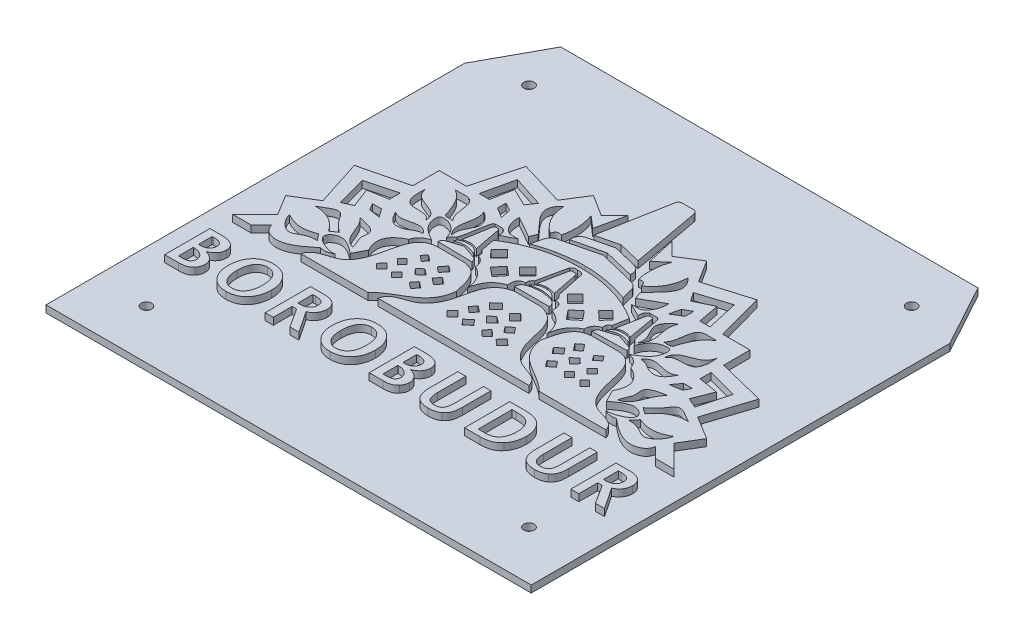
from build123d import *

# Parameters (mm, degrees)
SKETCH2_R           = 1.5
BOSS_EXTRUDE1_DEPTH = 2
BOSS_EXTRUDE6_DEPTH = 2
BOSS_EXTRUDE3_DEPTH = 2


with BuildPart() as part:
    # Sketch2 → Boss-Extrude1 (new body)
    with BuildSketch(Plane(origin=(0, 0, 0), x_dir=(1, 0, 0), z_dir=(0, 1, 0))):
        Polygon((-69.75, 120.33), (-69.75, 0), (69.75, 0), (69.75, 120.33), (59.98, 138.212299614), (-59.98, 138.212299614), align=None)
        with Locations((-55, 124.11)):
            Circle(SKETCH2_R, mode=Mode.SUBTRACT)
        with Locations((55, 124.11)):
            Circle(SKETCH2_R, mode=Mode.SUBTRACT)
        with Locations((55, 14.11)):
            Circle(SKETCH2_R, mode=Mode.SUBTRACT)
        with Locations((-55, 14.11)):
            Circle(SKETCH2_R, mode=Mode.SUBTRACT)
    extrude(amount=BOSS_EXTRUDE1_DEPTH)

    # Sketch5 → Boss-Extrude6 (add)
    # profile 1 of 13: a face of its own
    with BuildSketch(Plane(origin=(0, 2, 0), x_dir=(1, 0, 0), z_dir=(0, 1, 0))):
        with BuildLine():
            Line((-21.685947063, 47.375416064), (0, 47.375416064))
            Line((0, 47.375416064), (0, 56.834459975))
            Line((0, 56.834459975), (-1.725487697, 58.559947673))
            Line((-1.725487697, 58.559947673), (0, 59.906091426))
            Line((0, 59.906091426), (0, 68.72431732))
            Line((0, 68.72431732), (-3.705718193, 68.72431732))
            add(Edge.make_bspline(
                [(-21.685947063, 47.375416064), (-21.060258955, 50.473379201), (-15.335553224, 50.434784162), (-8.814152099, 58.667717265), (-10.54940112, 67.406769007), (-3.705718193, 68.72431732)],
                knots=[0, 0, 0, 0, 0.270546881, 0.473964292, 1, 1, 1, 1], degree=3))
        make_face()
        Polygon((-7.148873874, 52.624754299), (-8.719584105, 54.304881134), (-7.093908743, 55.82468599), (-5.523198513, 54.144559156), align=None, mode=Mode.SUBTRACT)
        Polygon((-4.951639177, 56.908027208), (-6.657904572, 58.248225413), (-5.375777566, 59.880557806), (-3.669512171, 58.540359601), align=None, mode=Mode.SUBTRACT)
        Polygon((-2.898048821, 52.784232434), (-4.319666773, 54.304881134), (-2.548662862, 55.960550161), (-1.12704491, 54.439901461), align=None, mode=Mode.SUBTRACT)
        Polygon((-2.898048821, 60.582139286), (-4.569985162, 62.254075627), (-2.635210078, 64.089457094), (-1.012970545, 62.467217561), align=None, mode=Mode.SUBTRACT)
    # profile 2 of 13: a face of its own
    with BuildSketch(Plane(origin=(0, 2, 0), x_dir=(1, 0, 0), z_dir=(0, 1, 0))):
        with BuildLine():
            Line((-43.862603547, 47.375416064), (-24.601773582, 47.375416064))
            add(Edge.make_bspline(
                [(-24.601773582, 47.375416064), (-20.405865535, 51.940580265), (-12.878495132, 52.375253293), (-12.146705328, 60.413761914)],
                knots=[0, 0, 0, 0, 1, 1, 1, 1], degree=3))
            add(Edge.make_bspline(
                [(-12.146705328, 60.413761914), (-13.085463449, 64.661349461), (-13.878737559, 68.672799202), (-18.730238522, 68.72431732)],
                knots=[0.605840474, 0.605840474, 0.605840474, 0.605840474, 1, 1, 1, 1], degree=3))
            Line((-18.730238522, 68.72431732), (-25.754130931, 68.72431732))
            add(Edge.make_bspline(
                [(-43.862603547, 47.375416064), (-42.952067047, 50.584414035), (-36.495790346, 50.097398851), (-31.364544587, 59.441623611), (-31.920905438, 68.658833235), (-25.754130931, 68.72431732)],
                knots=[0, 0, 0, 0, 0.285537985, 0.49898124, 1, 1, 1, 1], degree=3))
        make_face()
        Polygon((-29.245304108, 54.464676026), (-30.636489675, 55.837739367), (-29.093815535, 57.400774322), (-27.702629969, 56.027710981), align=None, mode=Mode.SUBTRACT)
        Polygon((-24.888496356, 54.464676026), (-26.279681923, 55.837739367), (-24.770847726, 57.366487746), (-23.379662159, 55.993424406), align=None, mode=Mode.SUBTRACT)
        Polygon((-27.191051852, 58.540359601), (-28.751244165, 60.080228127), (-27.406910157, 61.442305181), (-25.846717844, 59.902436654), align=None, mode=Mode.SUBTRACT)
        Polygon((-19.403651932, 54.464676026), (-21.15175938, 55.837739367), (-19.859856979, 57.482517245), (-18.111749532, 56.109453904), align=None, mode=Mode.SUBTRACT)
        Polygon((-23.709253906, 60.17330123), (-22.242184726, 61.464011125), (-20.528212778, 60.080228127), (-22.242184726, 58.540359601), align=None, mode=Mode.SUBTRACT)
        Polygon((-17.059132435, 58.719434182), (-18.910114644, 60.17330123), (-17.610300681, 61.828151667), (-15.759318472, 60.374284619), align=None, mode=Mode.SUBTRACT)
        Polygon((-24.601773582, 62.771532138), (-26.279681923, 64.089457094), (-25.221568029, 65.436588522), (-23.543659688, 64.118663566), align=None, mode=Mode.SUBTRACT)
        Polygon((-19.403651932, 62.467217561), (-20.994406375, 63.716686873), (-19.514400299, 65.60094783), (-17.923645856, 64.351478518), align=None, mode=Mode.SUBTRACT)
    # profile 3 of 13: a face of its own
    with BuildSketch(Plane(origin=(0, 2, 0), x_dir=(1, 0, 0), z_dir=(0, 1, 0))):
        with BuildLine():
            add(Edge.make_bspline(
                [(0, 84.072732516), (-10.605144416, 84.196980499), (-19.514400299, 78.444899873)],
                knots=[0, 0, 0, 1, 1, 1], degree=2))
            Line((-19.514400299, 78.444899873), (-18.730238522, 74.22402539))
            add(Edge.make_bspline(
                [(-18.730238522, 74.22402539), (-17.50465765, 73.60292555), (-17.823355982, 72.360168701)],
                knots=[0, 0, 0, 1, 1, 1], degree=2))
            add(Edge.make_bspline(
                [(-17.823355982, 72.360168701), (-15.651043662, 71.672558294), (-15.569397993, 69.324225287)],
                knots=[0, 0, 0, 1, 1, 1], degree=2))
            add(Edge.make_bspline(
                [(-15.569397993, 69.324225287), (-11.767100871, 67.373494286), (-11.422946411, 62.891858127)],
                knots=[0, 0, 0, 1, 1, 1], degree=2))
            add(Edge.make_bspline(
                [(-11.422946411, 62.891858127), (-10.806738639, 67.764759062), (-6.356849183, 69.324225287)],
                knots=[0, 0, 0, 1, 1, 1], degree=2))
            add(Edge.make_bspline(
                [(-4.308362372, 72.360168701), (-6.684498085, 72.443487873), (-6.356849183, 69.324225287)],
                knots=[0, 0, 0, 1, 1, 1], degree=2))
            add(Edge.make_bspline(
                [(-4.308362372, 72.360168701), (-4.471910005, 73.597868022), (-3.483689743, 74.22402539)],
                knots=[0, 0, 0, 1, 1, 1], degree=2))
            Line((-3.483689743, 74.22402539), (-1.725487697, 82.436599441))
            add(Edge.make_bspline(
                [(0, 83.069948021), (-1.111076659, 83.406438521), (-1.725487697, 82.436599441)],
                knots=[0, 0, 0, 1, 1, 1], degree=2))
            Line((0, 83.069948021), (0, 84.072732516))
        make_face()
        Polygon((-10.697634727, 69.150168696), (-13.267673722, 71.256828518), (-11.092987525, 73.909856914), (-8.52294853, 71.803197092), align=None, mode=Mode.SUBTRACT)
        Polygon((-15.569397993, 73.645589213), (-17.577881173, 75.719926188), (-15.108278915, 78.111126199), (-13.099795735, 76.036789224), align=None, mode=Mode.SUBTRACT)
        Polygon((-6.921347807, 73.280151554), (-9.106381439, 75.50434696), (-6.690376122, 77.877813275), (-4.50534249, 75.653617869), align=None, mode=Mode.SUBTRACT)
    # profile 4 of 13: a face of its own
    with BuildSketch(Plane(origin=(0, 2, 0), x_dir=(1, 0, 0), z_dir=(0, 1, 0))):
        with BuildLine():
            add(Edge.make_bspline(
                [(0, 82.001172293), (-0.546282657, 82.146451828), (-0.883939505, 81.893888755), (-1.012970545, 81.243483073)],
                knots=[0, 0, 0, 0, 1, 1, 1, 1], degree=3))
            Line((-1.012970545, 81.243483073), (-2.467855457, 73.909856914))
            add(Edge.make_bspline(
                [(0, 74.457217273), (-1.254338521, 74.275246977), (-2.467855457, 73.909856914)],
                knots=[0, 0, 0, 1, 1, 1], degree=2))
            Line((0, 74.457217273), (0, 82.001172293))
        make_face()
    # profile 5 of 13: a face of its own
    with BuildSketch(Plane(origin=(0, 2, 0), x_dir=(1, 0, 0), z_dir=(0, 1, 0))):
        with BuildLine():
            Line((-8.719584105, 89.505081705), (0, 91.601082332))
            Line((0, 91.601082332), (0, 94.090083078))
            Line((0, 94.090083078), (-6.921347807, 92.426339811))
            add(Edge.make_bspline(
                [(-6.921347807, 92.426339811), (-8.915714161, 91.748628923), (-8.719584105, 89.505081705)],
                knots=[0, 0, 0, 1, 1, 1], degree=2))
        make_face()
    # profile 6 of 13: a face of its own
    with BuildSketch(Plane(origin=(0, 2, 0), x_dir=(1, 0, 0), z_dir=(0, 1, 0))):
        with BuildLine():
            Line((-6.356849183, 94.090083078), (0, 95.618416869))
            Line((0, 95.618416869), (0, 114.802334585))
            Line((0, 114.802334585), (-1.460599159, 114.802334585))
            add(Edge.make_bspline(
                [(-2.773638411, 113.757871544), (-2.545004362, 114.841627513), (-1.460599159, 114.802334585)],
                knots=[0, 0, 0, 1, 1, 1], degree=2))
            Line((-2.773638411, 113.757871544), (-6.356849183, 94.090083078))
        make_face()
    # profile 7 of 13: a face of its own
    with BuildSketch(Plane(origin=(0, 2, 0), x_dir=(1, 0, 0), z_dir=(0, 1, 0))):
        with BuildLine():
            Line((0, 85.185550604), (0, 90.489540898))
            Line((0, 90.489540898), (-10.193302484, 87.973071407))
            add(Edge.make_bspline(
                [(-10.193302484, 87.973071407), (-11.712262793, 87.686106305), (-12.479258747, 86.366740633)],
                knots=[0, 0, 0, 1, 1, 1], degree=2))
            Line((-12.479258747, 86.366740633), (-13.435245105, 82.724397612))
            add(Edge.make_bspline(
                [(-13.435245105, 82.724397612), (-6.950689866, 85.146034045), (0, 85.185550604)],
                knots=[0, 0, 0, 1, 1, 1], degree=2))
        make_face()
    # profile 8 of 13: a face of its own
    with BuildSketch(Plane(origin=(0, 2, 0), x_dir=(1, 0, 0), z_dir=(0, 1, 0))):
        with BuildLine():
            Line((-8.193733671, 95.618416869), (-6.356849183, 103.918443139))
            Line((-6.356849183, 103.918443139), (-10.193302484, 100.081989839))
            Line((-10.193302484, 100.081989839), (-16.282384704, 103.918443139))
            Line((-16.282384704, 103.918443139), (-20.269820633, 97.589726661))
            Line((-20.269820633, 97.589726661), (-33.217016615, 101.470850103))
            Line((-33.217016615, 101.470850103), (-36.838711138, 87.973071407))
            Line((-36.838711138, 87.973071407), (-44.675064357, 87.973071407))
            Line((-44.675064357, 87.973071407), (-44.675064357, 80.394354512))
            Line((-44.675064357, 80.394354512), (-58.170820404, 77.050670469))
            Line((-58.170820404, 77.050670469), (-53.86305666, 63.735764351))
            Line((-53.86305666, 63.735764351), (-60.522708481, 59.674192515))
            Line((-60.522708481, 59.674192515), (-56.981509517, 53.867782317))
            Line((-56.981509517, 53.867782317), (-63.473875771, 47.375416064))
            Line((-63.473875771, 47.375416064), (-58.170820404, 47.375416064))
            Line((-58.170820404, 47.375416064), (-55.152153766, 50.394082702))
            add(Edge.make_bspline(
                [(-55.152153766, 50.394082702), (-54.896607666, 48.453862725), (-49.672270582, 45.698470367), (-44.861077302, 49.799119086), (-42.545623721, 51.713327892)],
                knots=[0, 0, 0, 0, 0.336939276, 1, 1, 1, 1], degree=3))
            add(Edge.make_bspline(
                [(-42.545623721, 51.713327892), (-40.660950606, 51.172930467), (-38.936225155, 52.262069486)],
                knots=[0, 0, 0, 1, 1, 1], degree=2))
            add(Edge.make_bspline(
                [(-38.936225155, 52.262069486), (-40.004542308, 51.708672366), (-47.04770612, 54.012503598), (-41.84608072, 58.747336878), (-38.331384044, 55.730766175), (-36.838711138, 54.539877226)],
                knots=[0, 0, 0, 0, 0.430133885, 0.559822654, 1, 1, 1, 1], degree=3))
            Line((-36.838711138, 54.539877226), (-35.014421637, 58.051707637))
            add(Edge.make_bspline(
                [(-35.014421637, 58.051707637), (-38.022264734, 63.518611764), (-31.943460414, 66.433353682)],
                knots=[0, 0, 0, 1, 1, 1], degree=2))
            add(Edge.make_bspline(
                [(-31.943460414, 66.433353682), (-31.089336219, 68.974456749), (-28.477832624, 69.557436335)],
                knots=[0, 0, 0, 1, 1, 1], degree=2))
            add(Edge.make_bspline(
                [(-28.477832624, 69.557436335), (-30.531971797, 70.80246416), (-33.22732518, 72.114260458), (-33.495995055, 76.718344296), (-29.666868317, 76.917194385), (-27.600331635, 74.751069735), (-26.965665509, 72.360168701)],
                knots=[0, 0, 0, 0, 0.406746933, 0.533052717, 0.591310573, 1, 1, 1, 1], degree=3))
            add(Edge.make_bspline(
                [(-26.965665509, 72.360168701), (-26.426092207, 73.293491741), (-25.546850669, 73.909856914)],
                knots=[0, 0, 0, 1, 1, 1], degree=2))
            add(Edge.make_bspline(
                [(-25.546850669, 73.909856914), (-24.533624412, 77.188877898), (-24.687426532, 79.262411391), (-23.838965761, 82.467379634), (-23.379662159, 82.724397612)],
                knots=[0, 0, 0, 0, 0.838059053, 1, 1, 1, 1], degree=3))
            Line((-23.379662159, 82.724397612), (-21.15175938, 82.724397612))
            add(Edge.make_bspline(
                [(-21.15175938, 82.724397612), (-19.820338229, 82.097804143), (-20.033682515, 80.394354512)],
                knots=[0, 0, 0, 1, 1, 1], degree=2))
            Line((-20.033682515, 80.394354512), (-16.282384704, 82.290049201))
            Line((-16.282384704, 82.290049201), (-18.730238522, 82.290049201))
            add(Edge.make_bspline(
                [(-21.473946494, 87.795967907), (-21.651320235, 85.706944754), (-20.741157941, 83.215314086), (-18.730238522, 82.290049201)],
                knots=[0, 0, 0, 0, 1, 1, 1, 1], degree=3))
            Line((-21.473946494, 87.795967907), (-15.382914795, 84.37249437))
            Line((-15.382914795, 84.37249437), (-14.607234621, 86.366740633))
            add(Edge.make_bspline(
                [(-17.823355982, 96.952208014), (-22.456785664, 92.859316657), (-16.859001025, 89.467206487), (-14.607234621, 86.366740633)],
                knots=[0, 0, 0, 0, 1, 1, 1, 1], degree=3))
            add(Edge.make_bspline(
                [(-17.823355982, 96.952208014), (-17.577869158, 91.407765522), (-13.108443862, 88.298374539)],
                knots=[0, 0, 0, 1, 1, 1], degree=2))
            add(Edge.make_bspline(
                [(-11.092987525, 89.505081705), (-12.825632139, 90.086815881), (-13.108443862, 88.298374539)],
                knots=[0, 0, 0, 1, 1, 1], degree=2))
            add(Edge.make_bspline(
                [(-11.608127068, 98.577547296), (-9.946740821, 94.151219529), (-11.092987525, 89.505081705)],
                knots=[0, 0, 0, 1, 1, 1], degree=2))
            Line((-11.608127068, 98.577547296), (-8.193733671, 95.618416869))
        make_face()
        with BuildLine():
            add(Edge.make_bspline(
                [(-55.152153766, 55.453674615), (-50.846199128, 52.864413107), (-46.306227135, 54.898343312)],
                knots=[0, 0, 0, 1, 1, 1], degree=2))
            Line((-46.306227135, 54.898343312), (-44.675064357, 52.954683753))
            add(Edge.make_bspline(
                [(-55.152153766, 55.453674615), (-55.074916803, 53.884746974), (-52.161074063, 50.127119855), (-48.277083317, 52.336513812), (-46.380781819, 53.264049619), (-44.675064357, 52.954683753)],
                knots=[0, 0, 0, 0, 0.513801539, 0.617376106, 1, 1, 1, 1], degree=3))
        make_face(mode=Mode.SUBTRACT)
        with BuildLine():
            Line((-43.66590592, 58.237606571), (-45.491439378, 56.981247199))
            add(Edge.make_bspline(
                [(-53.663369583, 61.332687709), (-52.06146859, 61.317415129), (-48.955474971, 60.667359118), (-46.585693663, 58.571236379), (-45.491439378, 56.981247199)],
                knots=[0.00519792, 0.00519792, 0.00519792, 0.00519792, 0.462660874, 1, 1, 1, 1], degree=3))
            add(Edge.make_bspline(
                [(-53.663369583, 61.332687709), (-53.159810356, 61.376361772), (-51.02221802, 63.139867278), (-48.191190741, 63.695675519), (-46.526940219, 60.572909899), (-45.029377376, 59.325441602), (-43.66590592, 58.237606571)],
                knots=[0.011540337, 0.011540337, 0.011540337, 0.011540337, 0.305760969, 0.436150392, 0.629288219, 0.980307848, 0.980307848, 0.980307848, 0.980307848], degree=3))
        make_face(mode=Mode.SUBTRACT)
        with BuildLine():
            add(Edge.make_bspline(
                [(-44.341456174, 64.856575027), (-41.415035499, 62.520759202), (-42.171272147, 57.6442623), (-38.029171466, 56.462113072)],
                knots=[0, 0, 0, 0, 1, 1, 1, 1], degree=3))
            add(Edge.make_bspline(
                [(-44.341456174, 64.856575027), (-43.362111113, 64.585255235), (-38.435539768, 64.16906248), (-39.739263745, 59.454525834), (-38.521201004, 58.512236145), (-38.029171466, 56.462113072)],
                knots=[0, 0, 0, 0, 0.474826613, 0.654778699, 1, 1, 1, 1], degree=3))
        make_face(mode=Mode.SUBTRACT)
        Polygon((-48.086153541, 67.06045108), (-50.967432225, 65.831670465), (-53.303401548, 74.457217273), (-44.675064357, 76.763580764), (-44.675064357, 73.645589213), (-50.289484299, 72.681020081), align=None, mode=Mode.SUBTRACT)
        Polygon((-44.950644386, 68.24685995), (-46.009938019, 70.128065635), (-43.432616461, 70.128065635), (-41.688019994, 67.73658245), align=None, mode=Mode.SUBTRACT)
        with BuildLine():
            add(Edge.make_bspline(
                [(-40.64572554, 71.394186706), (-40.148961681, 70.498089092), (-38.758331512, 67.674331104), (-34.408029759, 68.277937487), (-32.885232532, 70.103591604), (-31.282680848, 69.914345584)],
                knots=[0, 0, 0, 0, 0.360982783, 0.637936432, 1, 1, 1, 1], degree=3))
            add(Edge.make_bspline(
                [(-40.64572554, 71.394186706), (-37.590726625, 68.98929967), (-33.708894027, 73.606136142), (-31.282680848, 69.914345584)],
                knots=[0, 0, 0, 0, 1, 1, 1, 1], degree=3))
        make_face(mode=Mode.SUBTRACT)
        with BuildLine():
            add(Edge.make_bspline(
                [(-41.955522698, 81.243483073), (-42.22428706, 79.832064816), (-42.303268998, 73.087843744), (-35.319106899, 76.123005378), (-34.237886067, 73.645589213)],
                knots=[0, 0, 0, 0, 0.454885445, 1, 1, 1, 1], degree=3))
            add(Edge.make_bspline(
                [(-41.955522698, 81.243483073), (-41.302131938, 76.436217087), (-34.354173944, 78.682785762), (-34.237886067, 73.645589213)],
                knots=[0, 0, 0, 0, 1, 1, 1, 1], degree=3))
        make_face(mode=Mode.SUBTRACT)
        with BuildLine():
            add(Edge.make_bspline(
                [(-27.958861736, 84.072732516), (-26.78492251, 83.490954423), (-24.177587977, 81.021756454), (-26.325360358, 77.248666697), (-27.294488536, 75.217247875), (-26.783259703, 73.645589213)],
                knots=[0, 0, 0, 0, 0.404519616, 0.640918639, 1, 1, 1, 1], degree=3))
            add(Edge.make_bspline(
                [(-26.783259703, 73.645589213), (-29.966404665, 76.726432198), (-26.240813452, 80.589365636), (-27.958861736, 84.072732516)],
                knots=[0, 0, 0, 0, 1, 1, 1, 1], degree=3))
        make_face(mode=Mode.SUBTRACT)
        with BuildLine():
            add(Edge.make_bspline(
                [(-37.602051673, 85.511073009), (-35.321422363, 84.072264289), (-34.429990485, 82.514160022), (-32.827893949, 78.409112918), (-32.829169694, 77.553903826), (-31.858512233, 77.444557082), (-30.2456342, 77.533070382)],
                knots=[0, 0, 0, 0, 0.537998494, 0.598899625, 0.784193301, 1, 1, 1, 1], degree=3))
            add(Edge.make_bspline(
                [(-37.602051673, 85.511073009), (-36.289324477, 85.364697372), (-32.542283137, 86.252048183), (-31.549956338, 81.208411397), (-31.500238286, 78.846165322), (-30.2456342, 77.533070382)],
                knots=[0, 0, 0, 0, 0.366526676, 0.616997506, 1, 1, 1, 1], degree=3))
        make_face(mode=Mode.SUBTRACT)
        Polygon((-26.965665509, 87.010465432), (-26.965665509, 89.484432934), (-24.71046724, 88.247449183), (-23.963917516, 85.185550604), align=None, mode=Mode.SUBTRACT)
        Polygon((-29.101454657, 94.090083078), (-30.2456342, 87.973071407), (-33.217016615, 87.973071407), (-31.168124063, 96.952208014), (-22.242184726, 94.090083078), (-23.963917516, 91.601082332), align=None, mode=Mode.SUBTRACT)
    # profile 9 of 13: a face of its own
    with BuildSketch(Plane(origin=(0, 2, 0), x_dir=(1, 0, 0), z_dir=(0, 1, 0))):
        with BuildLine():
            Line((-17.823355982, 71.203215624), (-22.242184726, 72.681020081))
            Line((-22.242184726, 72.681020081), (-26.279681923, 71.394186706))
            add(Edge.make_bspline(
                [(-26.279681923, 71.394186706), (-27.100600825, 71.007259758), (-27.191051852, 70.128065635)],
                knots=[0, 0, 0, 1, 1, 1], degree=2))
            Line((-27.191051852, 70.128065635), (-17.170028295, 69.914345584))
            add(Edge.make_bspline(
                [(-17.170028295, 69.914345584), (-17.409964726, 70.6054808), (-17.823355982, 71.203215624)],
                knots=[0, 0, 0, 1, 1, 1], degree=2))
        make_face()
    # profile 10 of 13: a face of its own
    with BuildSketch(Plane(origin=(0, 2, 0), x_dir=(1, 0, 0), z_dir=(0, 1, 0))):
        with BuildLine():
            Line((0, 72.863683069), (0, 73.909856914))
            add(Edge.make_bspline(
                [(0, 73.909856914), (-2.061009085, 73.977492317), (-3.259865327, 72.360168701)],
                knots=[0, 0, 0, 1, 1, 1], degree=2))
            add(Edge.make_bspline(
                [(-3.259865327, 72.360168701), (-1.65571789, 72.776082937), (0, 72.863683069)],
                knots=[0, 0, 0, 1, 1, 1], degree=2))
        make_face()
    # profile 11 of 13: a face of its own
    with BuildSketch(Plane(origin=(0, 2, 0), x_dir=(1, 0, 0), z_dir=(0, 1, 0))):
        with BuildLine():
            Line((0, 69.914345584), (0, 72.518389135))
            add(Edge.make_bspline(
                [(0, 72.518389135), (-1.855205383, 72.198900744), (-4.97109912, 72.396342834), (-4.990840685, 69.914345584)],
                knots=[0, 0, 0, 0, 1, 1, 1, 1], degree=3))
            Line((-4.990840685, 69.914345584), (0, 69.914345584))
        make_face()
    # profile 12 of 13: a face of its own
    with BuildSketch(Plane(origin=(0, 2, 0), x_dir=(1, 0, 0), z_dir=(0, 1, 0))):
        with BuildLine():
            Line((-22.942476295, 81.459020177), (-24.240400614, 73.909856914))
            add(Edge.make_bspline(
                [(-24.240400614, 73.909856914), (-22.052597695, 75.052671214), (-19.859856979, 73.815253187)],
                knots=[0, 0, 0, 1, 1, 1], degree=2))
            Line((-19.859856979, 73.815253187), (-21.33837595, 81.459020177))
            add(Edge.make_bspline(
                [(-22.942476295, 81.459020177), (-22.87340473, 82.238055205), (-21.406887322, 82.247046407), (-21.33837595, 81.459020177)],
                knots=[0, 0, 0, 0, 1, 1, 1, 1], degree=3))
        make_face()
    # profile 13 of 13: a face of its own
    with BuildSketch(Plane(origin=(0, 2, 0), x_dir=(1, 0, 0), z_dir=(0, 1, 0))):
        with BuildLine():
            add(Edge.make_bspline(
                [(-25.080663656, 72.518389135), (-24.965710915, 73.512063672), (-22.215298508, 74.283838798), (-19.753844714, 73.76740847), (-19.075811587, 72.184269314)],
                knots=[0, 0, 0, 0, 0.375200626, 1, 1, 1, 1], degree=3))
            add(Edge.make_bspline(
                [(-25.080663656, 72.518389135), (-22.020877752, 73.767950381), (-19.075811587, 72.184269314)],
                knots=[0, 0, 0, 1, 1, 1], degree=2))
        make_face()
    boss_extrude6 = extrude(amount=BOSS_EXTRUDE6_DEPTH)

    # Sketch4 → Boss-Extrude3 (add)
    # profile 1 of 9: a face of its own
    with BuildSketch(Plane(origin=(0, 2, 0), x_dir=(1, 0, 0), z_dir=(0, 1, 0))):
        with BuildLine():
            Line((-63.190382072, 27.57485914), (-63.190382072, 40.57485914))
            Line((-63.190382072, 40.57485914), (-59.726972262, 40.57485914))
            add(Edge.make_bspline(
                [(-59.726972262, 40.57485914), (-59.560634849, 40.57231935), (-59.237839889, 40.567390626), (-58.768132822, 40.531438895), (-58.328098746, 40.471121102), (-57.917677881, 40.38302625), (-57.535167811, 40.273889278), (-57.18262391, 40.137390402), (-56.858349793, 39.978847229), (-56.567418163, 39.792455972), (-56.305905779, 39.58712148), (-56.078269653, 39.360538769), (-55.886582505, 39.113811344), (-55.726953643, 38.849802505), (-55.606828241, 38.564315861), (-55.518156126, 38.260920242), (-55.466756071, 37.937691212), (-55.459772266, 37.715861975), (-55.456204857, 37.602549013)],
                knots=[0, 0, 0, 0, 1.362329124, 2.643740613, 3.855923336, 4.997334728, 6.079255232, 7.1104524, 8.089960293, 9.030559553, 9.935048454, 10.808691022, 11.654038174, 12.488353738, 13.328085846, 14.183401101, 15.072060086, 16, 16, 16, 16], degree=3))
            add(Edge.make_bspline(
                [(-55.456204857, 37.602549013), (-55.457954779, 37.510742097), (-55.4614176, 37.329070632), (-55.496011669, 37.059697665), (-55.553315878, 36.796914938), (-55.629651371, 36.539154701), (-55.730403265, 36.288663349), (-55.855496366, 36.046393698), (-55.999680465, 35.80852983), (-56.165719013, 35.579015318), (-56.350082259, 35.361995413), (-56.548475637, 35.158662018), (-56.765996239, 34.977644603), (-56.994708486, 34.808700698), (-57.239616085, 34.660116168), (-57.499243616, 34.528078845), (-57.773105751, 34.411974097), (-57.964327371, 34.350266132), (-58.060833022, 34.31912338)],
                knots=[0, 0, 0, 0, 0.979780781, 1.938832256, 2.893640022, 3.848973806, 4.805621365, 5.771415319, 6.756947662, 7.772811149, 8.792130523, 9.795053602, 10.801477005, 11.809936653, 12.828434261, 13.855609147, 14.917769676, 16, 16, 16, 16], degree=3))
            add(Edge.make_bspline(
                [(-58.060833022, 34.31912338), (-57.935257914, 34.281936386), (-57.690582709, 34.209479865), (-57.338487691, 34.079904742), (-57.01165806, 33.936842493), (-56.707202388, 33.782716296), (-56.430303149, 33.611903091), (-56.173023439, 33.432516815), (-55.941771377, 33.236952261), (-55.734344291, 33.028496596), (-55.554291889, 32.804636623), (-55.392446132, 32.572329005), (-55.262648301, 32.321813959), (-55.14962772, 32.061767611), (-55.06581072, 31.786393975), (-55.007082949, 31.498797712), (-54.970005711, 31.198645158), (-54.96506084, 30.993811077), (-54.962533971, 30.889139203)],
                knots=[0, 0, 0, 0, 1.252214904, 2.439862028, 3.585003243, 4.662718613, 5.700128529, 6.693913851, 7.659411643, 8.59253357, 9.5014021, 10.403928705, 11.294918556, 12.194649511, 13.112418274, 14.041535909, 14.999208987, 16, 16, 16, 16], degree=3))
            add(Edge.make_bspline(
                [(-54.962533971, 30.889139203), (-54.965384743, 30.79648494), (-54.971025272, 30.613159474), (-55.004711675, 30.340153712), (-55.063626532, 30.072246924), (-55.149716124, 29.81070419), (-55.25548759, 29.552855821), (-55.386808217, 29.3019446), (-55.54231377, 29.055626258), (-55.660731895, 28.899057149), (-55.721038718, 28.819321165)],
                knots=[0, 0, 0, 0, 0.989353177, 1.957531433, 2.932217871, 3.913241294, 4.893795134, 5.90474953, 6.932951346, 8, 8, 8, 8], degree=3))
            add(Edge.make_bspline(
                [(-55.721038718, 28.819321165), (-55.811379958, 28.714234455), (-55.99125225, 28.505003463), (-56.316597462, 28.245895868), (-56.673873199, 28.026227117), (-57.00302485, 27.887132323), (-57.286373943, 27.794263465), (-57.51946243, 27.736359926), (-57.770244101, 27.687948057), (-58.038721532, 27.646911787), (-58.325099776, 27.613527217), (-58.630456992, 27.590512301), (-58.952940281, 27.578382255), (-59.174154436, 27.57605132), (-59.287296629, 27.57485914)],
                knots=[0, 0, 0, 0, 1.270750891, 2.530105562, 3.802270756, 5.114386342, 5.801682221, 6.540795849, 7.319137977, 8.147721502, 9.035587203, 9.967477548, 10.960446054, 12, 12, 12, 12], degree=3))
            Line((-59.287296629, 27.57485914), (-63.190382072, 27.57485914))
        make_face()
        with BuildLine():
            Line((-60.886584604, 29.22042876), (-60.855730174, 29.22042876))
            add(Edge.make_bspline(
                [(-60.855730174, 29.22042876), (-60.704011761, 29.220319728), (-60.415082001, 29.220112089), (-60.003703368, 29.234791928), (-59.63489019, 29.250744314), (-59.309289696, 29.277574393), (-59.025465178, 29.304937639), (-58.785838037, 29.348029769), (-58.586456537, 29.389570596), (-58.471867398, 29.432642313), (-58.420801376, 29.451836988)],
                knots=[0, 0, 0, 0, 1.482266668, 2.822801435, 4.021753692, 5.088575845, 6.015208937, 6.805456394, 7.467658198, 8, 8, 8, 8], degree=3))
            add(Edge.make_bspline(
                [(-58.420801376, 29.451836988), (-58.342355745, 29.488949595), (-58.189836477, 29.56110642), (-57.98725887, 29.705874348), (-57.812219041, 29.870030222), (-57.671723418, 30.061473412), (-57.562537885, 30.27510552), (-57.486254197, 30.511230019), (-57.43863728, 30.769815658), (-57.433540536, 30.94977038), (-57.430888402, 31.043411355)],
                knots=[0, 0, 0, 0, 1.039713238, 2.021480356, 2.974590915, 3.908637338, 4.856348109, 5.841987667, 6.877059873, 8, 8, 8, 8], degree=3))
            add(Edge.make_bspline(
                [(-57.430888402, 31.043411355), (-57.43393898, 31.128455973), (-57.439957935, 31.296253567), (-57.485221463, 31.542306229), (-57.557414227, 31.779224376), (-57.659961561, 32.005042761), (-57.79422746, 32.219303141), (-57.956955739, 32.422343215), (-58.148767953, 32.615547434), (-58.365878962, 32.797274189), (-58.606951796, 32.960453248), (-58.864613612, 33.103815898), (-59.135658983, 33.230209152), (-59.424752051, 33.325305769), (-59.727812894, 33.403662376), (-60.045834556, 33.459488893), (-60.379293337, 33.493898693), (-60.606238014, 33.497216826), (-60.722027642, 33.498909773)],
                knots=[0, 0, 0, 0, 0.894144232, 1.764194531, 2.622536105, 3.493986475, 4.364550394, 5.275489014, 6.225343975, 7.223797199, 8.248998366, 9.282254075, 10.323072634, 11.389310387, 12.478212914, 13.613557871, 14.782411422, 16, 16, 16, 16], degree=3))
            Line((-60.722027642, 33.498909773), (-60.886584604, 33.498909773))
            Line((-60.886584604, 33.498909773), (-60.886584604, 29.22042876))
        make_face(mode=Mode.SUBTRACT)
        with BuildLine():
            Line((-60.886584604, 34.979922431), (-60.637177958, 34.979922431))
            add(Edge.make_bspline(
                [(-60.637177958, 34.979922431), (-60.524006699, 34.98227492), (-60.304226831, 34.986843482), (-59.984481868, 35.011245976), (-59.685448046, 35.057489802), (-59.407437827, 35.122405228), (-59.148681122, 35.199595956), (-58.912795513, 35.302002835), (-58.695835903, 35.419462045), (-58.499121342, 35.556488348), (-58.324535487, 35.709822756), (-58.172899743, 35.880060119), (-58.043100531, 36.064691909), (-57.941794294, 36.267797785), (-57.856136062, 36.482745971), (-57.803108446, 36.715258364), (-57.76374723, 36.96184216), (-57.761275796, 37.131842694), (-57.760002326, 37.219439836)],
                knots=[0, 0, 0, 0, 1.312680442, 2.549240275, 3.716077788, 4.817982517, 5.858647313, 6.842756131, 7.794714152, 8.715706293, 9.617126575, 10.483047133, 11.354370684, 12.225694235, 13.109906139, 14.030844638, 14.985342117, 16, 16, 16, 16], degree=3))
            add(Edge.make_bspline(
                [(-57.760002326, 37.219439836), (-57.761573702, 37.289023873), (-57.764619955, 37.423918702), (-57.799749331, 37.618850876), (-57.853228897, 37.800427811), (-57.928639782, 37.96885993), (-58.023467712, 38.125281156), (-58.14511597, 38.265468587), (-58.285729609, 38.393366624), (-58.448147899, 38.507884328), (-58.631454399, 38.608926601), (-58.83833216, 38.690759918), (-59.063007976, 38.768081832), (-59.311704636, 38.824370281), (-59.579872872, 38.874196665), (-59.871092829, 38.907300464), (-60.182738476, 38.923682107), (-60.398039144, 38.92738679), (-60.508617832, 38.92928952)],
                knots=[0, 0, 0, 0, 0.912554305, 1.76906747, 2.591416314, 3.392314647, 4.185508419, 4.98371465, 5.820108707, 6.675586453, 7.587099544, 8.560870266, 9.59278258, 10.703582191, 11.90427079, 13.172999656, 14.548049147, 16, 16, 16, 16], degree=3))
            Line((-60.508617832, 38.92928952), (-60.886584604, 38.92928952))
            Line((-60.886584604, 38.92928952), (-60.886584604, 34.979922431))
        make_face(mode=Mode.SUBTRACT)
    # profile 2 of 9: a face of its own
    with BuildSketch(Plane(origin=(0, 2, 0), x_dir=(1, 0, 0), z_dir=(0, 1, 0))):
        with BuildLine():
            add(Edge.make_bspline(
                [(-45.286584604, 27.245745216), (-45.51228832, 27.250711534), (-45.953475614, 27.260419288), (-46.597860679, 27.349978518), (-47.20692935, 27.496005635), (-47.782011679, 27.69903018), (-48.321120416, 27.963370615), (-48.824685473, 28.287323762), (-49.295890447, 28.66698394), (-49.726380026, 29.104712327), (-50.114097342, 29.589869933), (-50.451754451, 30.116856611), (-50.739255785, 30.681526172), (-50.973720699, 31.285289069), (-51.151907642, 31.929307819), (-51.283619011, 32.609963605), (-51.361077955, 33.329984056), (-51.370414023, 33.822692335), (-51.375192199, 34.07485914)],
                knots=[0, 0, 0, 0, 1.04988093, 2.052221971, 3.02056282, 3.960392271, 4.884372062, 5.80819689, 6.741299476, 7.694565407, 8.659425506, 9.626385429, 10.602090815, 11.603479166, 12.635102297, 13.707522298, 14.826715928, 16, 16, 16, 16], degree=3))
            add(Edge.make_bspline(
                [(-51.375192199, 34.07485914), (-51.370394129, 34.327021752), (-51.361019188, 34.819721839), (-51.283927452, 35.538962778), (-51.151493194, 36.218600135), (-50.973909546, 36.861947274), (-50.738427325, 37.466038619), (-50.45331624, 38.032060538), (-50.113098525, 38.55747152), (-49.726683045, 39.042740654), (-49.29485536, 39.479708857), (-48.826448961, 39.863168699), (-48.318986474, 40.183365043), (-47.780857957, 40.450924042), (-47.205012954, 40.653095058), (-46.597118391, 40.800148151), (-45.953452907, 40.889220323), (-45.512280636, 40.898980121), (-45.286584604, 40.903973064)],
                knots=[0, 0, 0, 0, 1.173422404, 2.292747988, 3.361378182, 4.393122943, 5.394629358, 6.374006117, 7.337725989, 8.302699846, 9.256078168, 10.191802304, 11.113589481, 12.043017773, 12.982958032, 13.947536069, 14.949995288, 16, 16, 16, 16], degree=3))
            add(Edge.make_bspline(
                [(-45.286584604, 40.903973064), (-45.052273712, 40.899309773), (-44.593829205, 40.89018574), (-43.926090905, 40.796420686), (-43.293451757, 40.652722503), (-42.700268513, 40.442380134), (-42.142026676, 40.177953258), (-41.626064876, 39.848059586), (-41.145346163, 39.462206049), (-40.708874362, 39.016823117), (-40.313210369, 38.52764572), (-39.969427107, 37.997629863), (-39.680673189, 37.430926508), (-39.44384979, 36.828912874), (-39.257848012, 36.191329542), (-39.129034981, 35.517195116), (-39.046562352, 34.807989293), (-39.037864503, 34.322788588), (-39.033420047, 34.07485914)],
                knots=[0, 0, 0, 0, 1.076622274, 2.106481542, 3.093843531, 4.054713365, 4.994117713, 5.927677438, 6.863703814, 7.822219533, 8.789017835, 9.751929696, 10.72119817, 11.70830851, 12.722113646, 13.770027837, 14.860521505, 16, 16, 16, 16], degree=3))
            add(Edge.make_bspline(
                [(-39.033420047, 34.07485914), (-39.037928615, 33.826940136), (-39.046767428, 33.340907911), (-39.128559749, 32.630715062), (-39.258663577, 31.956286988), (-39.440706119, 31.317859578), (-39.677774359, 30.715582911), (-39.969703499, 30.150039642), (-40.313471639, 29.620500015), (-40.705090385, 29.129238341), (-41.144896289, 28.688221564), (-41.621913739, 28.297327101), (-42.142151954, 27.973929226), (-42.697998433, 27.706321541), (-43.291000062, 27.497207043), (-43.923485784, 27.353237872), (-44.59211765, 27.259429631), (-45.051417575, 27.250379163), (-45.286584604, 27.245745216)],
                knots=[0, 0, 0, 0, 1.139233166, 2.233406972, 3.281095549, 4.293586971, 5.280484787, 6.251344728, 7.214049276, 8.17817151, 9.13368299, 10.071984022, 11.006572474, 11.942223167, 12.902886126, 13.890035538, 14.919673078, 16, 16, 16, 16], degree=3))
        make_face()
        with BuildLine():
            add(Edge.make_bspline(
                [(-45.286584604, 28.891314836), (-45.142348358, 28.89488758), (-44.860082117, 28.901879339), (-44.448444958, 28.967763308), (-44.061003812, 29.075448303), (-43.698113632, 29.225272455), (-43.359995875, 29.417408793), (-43.046765138, 29.65373471), (-42.758201632, 29.933104295), (-42.495408788, 30.253338889), (-42.261893423, 30.612850618), (-42.055495915, 31.006547166), (-41.883846936, 31.436967854), (-41.741738702, 31.901171404), (-41.636655354, 32.401572458), (-41.555950458, 32.934476993), (-41.510219307, 33.502392267), (-41.504643938, 33.892223929), (-41.501774477, 34.092857557)],
                knots=[0, 0, 0, 0, 0.95352057, 1.866012696, 2.749113222, 3.608231015, 4.456278502, 5.314610294, 6.196691157, 7.106961516, 8.048849422, 9.027669002, 10.04253589, 11.109583688, 12.234906327, 13.421537003, 14.672949282, 16, 16, 16, 16], degree=3))
            add(Edge.make_bspline(
                [(-41.501774477, 34.092857557), (-41.504616862, 34.291783492), (-41.510138301, 34.678204615), (-41.556210465, 35.240914001), (-41.635715883, 35.769143999), (-41.745073097, 36.263662561), (-41.886453665, 36.72395743), (-42.058786315, 37.150105398), (-42.261602357, 37.544100279), (-42.498576747, 37.900527685), (-42.759699059, 38.221946186), (-43.050304568, 38.498411328), (-43.362426122, 38.735054545), (-43.700766983, 38.926812585), (-44.062406216, 39.077095779), (-44.449664775, 39.181502834), (-44.860035343, 39.248004678), (-45.14233254, 39.254886749), (-45.286584604, 39.258403444)],
                knots=[0, 0, 0, 0, 1.321931509, 2.567901765, 3.748872939, 4.869611187, 5.930810184, 6.945191616, 7.920951225, 8.870420642, 9.784991243, 10.667294854, 11.529681522, 12.381735301, 13.244911683, 14.125172007, 15.041974869, 16, 16, 16, 16], degree=3))
            add(Edge.make_bspline(
                [(-45.286584604, 39.258403444), (-45.420527286, 39.254599234), (-45.683034812, 39.247143554), (-46.067360189, 39.184069247), (-46.430940517, 39.079025601), (-46.773750276, 38.930967794), (-47.094966117, 38.741715368), (-47.394984799, 38.510718326), (-47.674647272, 38.238230872), (-47.931046102, 37.923921843), (-48.161749342, 37.571464505), (-48.364649908, 37.182993721), (-48.529325783, 36.755791386), (-48.66921002, 36.293704194), (-48.775414907, 35.794688953), (-48.852025469, 35.259566946), (-48.898597709, 34.688490414), (-48.904038322, 34.29521561), (-48.906837769, 34.092857557)],
                knots=[0, 0, 0, 0, 0.905866815, 1.775362819, 2.626920279, 3.460738132, 4.295201074, 5.143097521, 6.016626093, 6.931433207, 7.88202747, 8.862489859, 9.890931759, 10.975199444, 12.126311355, 13.33929097, 14.630942303, 16, 16, 16, 16], degree=3))
            add(Edge.make_bspline(
                [(-48.906837769, 34.092857557), (-48.904044018, 33.88878444), (-48.898613217, 33.492084586), (-48.851932313, 32.915901484), (-48.775776359, 32.376400005), (-48.66866234, 31.873353184), (-48.52998988, 31.4074431), (-48.36379942, 30.976646088), (-48.163188974, 30.584382404), (-47.931036794, 30.230860654), (-47.673765594, 29.916717728), (-47.396002486, 29.64131179), (-47.094095775, 29.41108168), (-46.774525526, 29.218441131), (-46.432019965, 29.070466185), (-46.067665373, 28.969076798), (-45.684176142, 28.901753868), (-45.420579762, 28.894832968), (-45.286584604, 28.891314836)],
                knots=[0, 0, 0, 0, 1.374329448, 2.671573298, 3.890424906, 5.041907675, 6.132268139, 7.161373192, 8.147602944, 9.093843773, 10.004461348, 10.878023224, 11.722036563, 12.555621368, 13.385620587, 14.226132478, 15.098281781, 16, 16, 16, 16], degree=3))
        make_face(mode=Mode.SUBTRACT)
    # profile 3 of 9: a face of its own
    with BuildSketch(Plane(origin=(0, 2, 0), x_dir=(1, 0, 0), z_dir=(0, 1, 0))):
        with BuildLine():
            Line((-34.294179541, 27.57485914), (-34.294179541, 40.57485914))
            Line((-34.294179541, 40.57485914), (-30.311386819, 40.57485914))
            add(Edge.make_bspline(
                [(-30.311386819, 40.57485914), (-30.151890999, 40.572656442), (-29.840906771, 40.568361633), (-29.388801596, 40.527464565), (-28.966597293, 40.457156814), (-28.571488198, 40.366890269), (-28.207043971, 40.242894595), (-27.869414192, 40.094151668), (-27.562114406, 39.915761842), (-27.283633832, 39.712486931), (-27.034711424, 39.486015793), (-26.820488788, 39.234352512), (-26.637393573, 38.963776994), (-26.484561921, 38.67255748), (-26.374059842, 38.357259321), (-26.291634303, 38.023281252), (-26.237681583, 37.668570121), (-26.233193126, 37.424481354), (-26.230888402, 37.299147114)],
                knots=[0, 0, 0, 0, 1.290583137, 2.516373155, 3.669208613, 4.752664155, 5.792341044, 6.779708414, 7.733821168, 8.661939487, 9.565233447, 10.450722791, 11.32988713, 12.204717746, 13.104275762, 14.026152812, 14.986472673, 16, 16, 16, 16], degree=3))
            add(Edge.make_bspline(
                [(-26.230888402, 37.299147114), (-26.232928901, 37.200520501), (-26.236984467, 37.004496501), (-26.267525246, 36.713615477), (-26.32324746, 36.430690756), (-26.393478531, 36.153776236), (-26.490584752, 35.88548522), (-26.605754501, 35.623035225), (-26.742617251, 35.367817749), (-26.899569827, 35.121583341), (-27.072650642, 34.886614315), (-27.261649998, 34.667385069), (-27.462490675, 34.462588447), (-27.678900507, 34.276257564), (-27.906162501, 34.101968756), (-28.148132048, 33.944722584), (-28.405276815, 33.806452302), (-28.583879571, 33.726660007), (-28.673530807, 33.686607557)],
                knots=[0, 0, 0, 0, 1.023519239, 2.034281908, 3.030379068, 4.014168393, 4.996025718, 5.987664977, 6.986498618, 7.998200148, 9.015788814, 10.012402117, 10.999883876, 11.989766323, 12.973555648, 13.970288024, 14.981168098, 16, 16, 16, 16], degree=3))
            Line((-28.673530807, 33.686607557), (-24.585318781, 27.57485914))
            Line((-24.585318781, 27.57485914), (-27.197660553, 27.57485914))
            Line((-27.197660553, 27.57485914), (-30.694495996, 33.005238887))
            Line((-30.694495996, 33.005238887), (-31.990382072, 33.005238887))
            Line((-31.990382072, 33.005238887), (-31.990382072, 27.57485914))
            Line((-31.990382072, 27.57485914), (-34.294179541, 27.57485914))
        make_face()
        with BuildLine():
            Line((-31.990382072, 34.650808507), (-31.740975427, 34.650808507))
            add(Edge.make_bspline(
                [(-31.740975427, 34.650808507), (-31.612367061, 34.652914174), (-31.362542595, 34.657004478), (-31.000059333, 34.684723666), (-30.662286886, 34.732846862), (-30.349175675, 34.801930078), (-30.061151394, 34.891751898), (-29.796160856, 34.999441774), (-29.556588303, 35.127967548), (-29.340470305, 35.275589823), (-29.149510915, 35.442162976), (-28.985055132, 35.630374162), (-28.847245055, 35.836989618), (-28.72837626, 36.059489338), (-28.642628972, 36.3026762), (-28.581092401, 36.563041399), (-28.541423981, 36.841122009), (-28.536972106, 37.033317816), (-28.53468587, 37.13201895)],
                knots=[0, 0, 0, 0, 1.336446071, 2.596074721, 3.775030883, 4.879218195, 5.9243162, 6.906777425, 7.847201582, 8.743973421, 9.621204624, 10.473298707, 11.332946512, 12.197425259, 13.087716357, 14.003655333, 14.974787819, 16, 16, 16, 16], degree=3))
            add(Edge.make_bspline(
                [(-28.53468587, 37.13201895), (-28.536479572, 37.205002408), (-28.539957622, 37.346519793), (-28.572054151, 37.55159018), (-28.621538743, 37.743492816), (-28.698749181, 37.918985326), (-28.789789727, 38.083952105), (-28.908494027, 38.229854065), (-29.042142413, 38.366652185), (-29.201226293, 38.483202699), (-29.377802505, 38.590490955), (-29.576200709, 38.682333612), (-29.795829409, 38.759357044), (-30.036203392, 38.820032292), (-30.296448295, 38.868464444), (-30.577921833, 38.904808131), (-30.880200761, 38.92436526), (-31.088721284, 38.927617953), (-31.19588049, 38.92928952)],
                knots=[0, 0, 0, 0, 0.960655628, 1.862743634, 2.728128611, 3.562700094, 4.381858034, 5.201715811, 6.031923592, 6.894431934, 7.790850831, 8.750444521, 9.768051655, 10.852357116, 12.0125803, 13.253226618, 14.588426451, 16, 16, 16, 16], degree=3))
            Line((-31.19588049, 38.92928952), (-31.990382072, 38.92928952))
            Line((-31.990382072, 38.92928952), (-31.990382072, 34.650808507))
        make_face(mode=Mode.SUBTRACT)
    # profile 4 of 9: a face of its own
    with BuildSketch(Plane(origin=(0, 2, 0), x_dir=(1, 0, 0), z_dir=(0, 1, 0))):
        with BuildLine():
            add(Edge.make_bspline(
                [(-15.4030403, 27.245745216), (-15.628744017, 27.250711534), (-16.06993131, 27.260419288), (-16.714316375, 27.349978518), (-17.323385046, 27.496005635), (-17.898467375, 27.69903018), (-18.437576112, 27.963370615), (-18.94114117, 28.287323762), (-19.412346143, 28.66698394), (-19.842835722, 29.104712327), (-20.230553038, 29.589869933), (-20.568210147, 30.116856611), (-20.855711482, 30.681526172), (-21.090176395, 31.285289069), (-21.268363338, 31.929307819), (-21.400074707, 32.609963605), (-21.477533651, 33.329984056), (-21.48686972, 33.822692335), (-21.491647895, 34.07485914)],
                knots=[0, 0, 0, 0, 1.04988093, 2.052221971, 3.02056282, 3.960392271, 4.884372062, 5.80819689, 6.741299476, 7.694565407, 8.659425506, 9.626385429, 10.602090815, 11.603479166, 12.635102297, 13.707522298, 14.826715928, 16, 16, 16, 16], degree=3))
            add(Edge.make_bspline(
                [(-21.491647895, 34.07485914), (-21.486849825, 34.327021752), (-21.477474884, 34.819721839), (-21.400383148, 35.538962778), (-21.26794889, 36.218600135), (-21.090365242, 36.861947274), (-20.854883021, 37.466038619), (-20.569771937, 38.032060538), (-20.229554221, 38.55747152), (-19.843138742, 39.042740654), (-19.411311056, 39.479708857), (-18.942904657, 39.863168699), (-18.43544217, 40.183365043), (-17.897313654, 40.450924042), (-17.32146865, 40.653095058), (-16.713574087, 40.800148151), (-16.069908603, 40.889220323), (-15.628736332, 40.898980121), (-15.4030403, 40.903973064)],
                knots=[0, 0, 0, 0, 1.173422404, 2.292747988, 3.361378182, 4.393122943, 5.394629358, 6.374006117, 7.337725989, 8.302699846, 9.256078168, 10.191802304, 11.113589481, 12.043017773, 12.982958032, 13.947536069, 14.949995288, 16, 16, 16, 16], degree=3))
            add(Edge.make_bspline(
                [(-15.4030403, 40.903973064), (-15.168729409, 40.899309773), (-14.710284901, 40.89018574), (-14.042546601, 40.796420686), (-13.409907454, 40.652722503), (-12.816724209, 40.442380134), (-12.258482372, 40.177953258), (-11.742520573, 39.848059586), (-11.261801859, 39.462206049), (-10.825330058, 39.016823117), (-10.429666066, 38.52764572), (-10.085882803, 37.997629863), (-9.797128885, 37.430926508), (-9.560305487, 36.828912874), (-9.374303709, 36.191329542), (-9.245490677, 35.517195116), (-9.163018048, 34.807989293), (-9.154320199, 34.322788588), (-9.149875743, 34.07485914)],
                knots=[0, 0, 0, 0, 1.076622274, 2.106481542, 3.093843531, 4.054713365, 4.994117713, 5.927677438, 6.863703814, 7.822219533, 8.789017835, 9.751929696, 10.72119817, 11.70830851, 12.722113646, 13.770027837, 14.860521505, 16, 16, 16, 16], degree=3))
            add(Edge.make_bspline(
                [(-9.149875743, 34.07485914), (-9.154384312, 33.826940136), (-9.163223124, 33.340907911), (-9.245015445, 32.630715062), (-9.375119273, 31.956286988), (-9.557161816, 31.317859578), (-9.794230055, 30.715582911), (-10.086159196, 30.150039642), (-10.429927335, 29.620500015), (-10.821546082, 29.129238341), (-11.261351985, 28.688221564), (-11.738369435, 28.297327101), (-12.25860765, 27.973929226), (-12.814454129, 27.706321541), (-13.407455758, 27.497207043), (-14.03994148, 27.353237872), (-14.708573346, 27.259429631), (-15.167873271, 27.250379163), (-15.4030403, 27.245745216)],
                knots=[0, 0, 0, 0, 1.139233166, 2.233406972, 3.281095549, 4.293586971, 5.280484787, 6.251344728, 7.214049276, 8.17817151, 9.13368299, 10.071984022, 11.006572474, 11.942223167, 12.902886126, 13.890035538, 14.919673078, 16, 16, 16, 16], degree=3))
        make_face()
        with BuildLine():
            add(Edge.make_bspline(
                [(-15.4030403, 28.891314836), (-15.258804054, 28.89488758), (-14.976537813, 28.901879339), (-14.564900654, 28.967763308), (-14.177459508, 29.075448303), (-13.814569328, 29.225272455), (-13.476451571, 29.417408793), (-13.163220834, 29.65373471), (-12.874657329, 29.933104295), (-12.611864484, 30.253338889), (-12.378349119, 30.612850618), (-12.171951611, 31.006547166), (-12.000302632, 31.436967854), (-11.858194398, 31.901171404), (-11.75311105, 32.401572458), (-11.672406154, 32.934476993), (-11.626675004, 33.502392267), (-11.621099634, 33.892223929), (-11.618230174, 34.092857557)],
                knots=[0, 0, 0, 0, 0.95352057, 1.866012696, 2.749113222, 3.608231015, 4.456278502, 5.314610294, 6.196691157, 7.106961516, 8.048849422, 9.027669002, 10.04253589, 11.109583688, 12.234906327, 13.421537003, 14.672949282, 16, 16, 16, 16], degree=3))
            add(Edge.make_bspline(
                [(-11.618230174, 34.092857557), (-11.621072558, 34.291783492), (-11.626593997, 34.678204615), (-11.672666161, 35.240914001), (-11.752171579, 35.769143999), (-11.861528793, 36.263662561), (-12.002909361, 36.72395743), (-12.175242011, 37.150105398), (-12.378058053, 37.544100279), (-12.615032443, 37.900527685), (-12.876154755, 38.221946186), (-13.166760264, 38.498411328), (-13.478881819, 38.735054545), (-13.81722268, 38.926812585), (-14.178861912, 39.077095779), (-14.566120471, 39.181502834), (-14.976491039, 39.248004678), (-15.258788236, 39.254886749), (-15.4030403, 39.258403444)],
                knots=[0, 0, 0, 0, 1.321931509, 2.567901765, 3.748872939, 4.869611187, 5.930810184, 6.945191616, 7.920951225, 8.870420642, 9.784991243, 10.667294854, 11.529681522, 12.381735301, 13.244911683, 14.125172007, 15.041974869, 16, 16, 16, 16], degree=3))
            add(Edge.make_bspline(
                [(-15.4030403, 39.258403444), (-15.536982982, 39.254599234), (-15.799490508, 39.247143554), (-16.183815885, 39.184069247), (-16.547396213, 39.079025601), (-16.890205972, 38.930967794), (-17.211421813, 38.741715368), (-17.511440496, 38.510718326), (-17.791102968, 38.238230872), (-18.047501798, 37.923921843), (-18.278205038, 37.571464505), (-18.481105605, 37.182993721), (-18.645781479, 36.755791386), (-18.785665716, 36.293704194), (-18.891870604, 35.794688953), (-18.968481165, 35.259566946), (-19.015053405, 34.688490414), (-19.020494018, 34.29521561), (-19.023293465, 34.092857557)],
                knots=[0, 0, 0, 0, 0.905866815, 1.775362819, 2.626920279, 3.460738132, 4.295201074, 5.143097521, 6.016626093, 6.931433207, 7.88202747, 8.862489859, 9.890931759, 10.975199444, 12.126311355, 13.33929097, 14.630942303, 16, 16, 16, 16], degree=3))
            add(Edge.make_bspline(
                [(-19.023293465, 34.092857557), (-19.020499714, 33.88878444), (-19.015068913, 33.492084586), (-18.968388009, 32.915901484), (-18.892232055, 32.376400005), (-18.785118037, 31.873353184), (-18.646445577, 31.4074431), (-18.480255116, 30.976646088), (-18.27964467, 30.584382404), (-18.04749249, 30.230860654), (-17.79022129, 29.916717728), (-17.512458182, 29.64131179), (-17.210551471, 29.41108168), (-16.890981222, 29.218441131), (-16.548475661, 29.070466185), (-16.184121069, 28.969076798), (-15.800631839, 28.901753868), (-15.537035458, 28.894832968), (-15.4030403, 28.891314836)],
                knots=[0, 0, 0, 0, 1.374329448, 2.671573298, 3.890424906, 5.041907675, 6.132268139, 7.161373192, 8.147602944, 9.093843773, 10.004461348, 10.878023224, 11.722036563, 12.555621368, 13.385620587, 14.226132478, 15.098281781, 16, 16, 16, 16], degree=3))
        make_face(mode=Mode.SUBTRACT)
    # profile 5 of 9: a face of its own
    with BuildSketch(Plane(origin=(0, 2, 0), x_dir=(1, 0, 0), z_dir=(0, 1, 0))):
        with BuildLine():
            Line((-4.410635237, 27.57485914), (-4.410635237, 40.57485914))
            Line((-4.410635237, 40.57485914), (-0.947225427, 40.57485914))
            add(Edge.make_bspline(
                [(-0.947225427, 40.57485914), (-0.780888014, 40.57231935), (-0.458093054, 40.567390626), (0.011614013, 40.531438895), (0.45164809, 40.471121102), (0.862068954, 40.38302625), (1.244579025, 40.273889278), (1.597122925, 40.137390402), (1.921397043, 39.978847229), (2.212328672, 39.792455972), (2.473841057, 39.58712148), (2.701477182, 39.360538769), (2.89316433, 39.113811344), (3.052793192, 38.849802505), (3.172918595, 38.564315861), (3.26159071, 38.260920242), (3.312990765, 37.937691212), (3.319974569, 37.715861975), (3.323541978, 37.602549013)],
                knots=[0, 0, 0, 0, 1.362329124, 2.643740613, 3.855923336, 4.997334728, 6.079255232, 7.1104524, 8.089960293, 9.030559553, 9.935048454, 10.808691022, 11.654038174, 12.488353738, 13.328085846, 14.183401101, 15.072060086, 16, 16, 16, 16], degree=3))
            add(Edge.make_bspline(
                [(3.323541978, 37.602549013), (3.321792056, 37.510742097), (3.318329235, 37.329070632), (3.283735167, 37.059697665), (3.226430957, 36.796914938), (3.150095464, 36.539154701), (3.04934357, 36.288663349), (2.924250469, 36.046393698), (2.780066371, 35.80852983), (2.614027823, 35.579015318), (2.429664576, 35.361995413), (2.231271199, 35.158662018), (2.013750597, 34.977644603), (1.78503835, 34.808700698), (1.54013075, 34.660116168), (1.28050322, 34.528078845), (1.006641084, 34.411974097), (0.815419465, 34.350266132), (0.718913814, 34.31912338)],
                knots=[0, 0, 0, 0, 0.979780781, 1.938832256, 2.893640022, 3.848973806, 4.805621365, 5.771415319, 6.756947662, 7.772811149, 8.792130523, 9.795053602, 10.801477005, 11.809936653, 12.828434261, 13.855609147, 14.917769676, 16, 16, 16, 16], degree=3))
            add(Edge.make_bspline(
                [(0.718913814, 34.31912338), (0.844488922, 34.281936386), (1.089164126, 34.209479865), (1.441259144, 34.079904742), (1.768088776, 33.936842493), (2.072544447, 33.782716296), (2.349443686, 33.611903091), (2.606723396, 33.432516815), (2.837975458, 33.236952261), (3.045402545, 33.028496596), (3.225454947, 32.804636623), (3.387300703, 32.572329005), (3.517098535, 32.321813959), (3.630119116, 32.061767611), (3.713936115, 31.786393975), (3.772663886, 31.498797712), (3.809741125, 31.198645158), (3.814685995, 30.993811077), (3.817212864, 30.889139203)],
                knots=[0, 0, 0, 0, 1.252214904, 2.439862028, 3.585003243, 4.662718613, 5.700128529, 6.693913851, 7.659411643, 8.59253357, 9.5014021, 10.403928705, 11.294918556, 12.194649511, 13.112418274, 14.041535909, 14.999208987, 16, 16, 16, 16], degree=3))
            add(Edge.make_bspline(
                [(3.817212864, 30.889139203), (3.814362092, 30.79648494), (3.808721563, 30.613159474), (3.77503516, 30.340153712), (3.716120303, 30.072246924), (3.630030711, 29.81070419), (3.524259246, 29.552855821), (3.392938619, 29.3019446), (3.237433065, 29.055626258), (3.119014941, 28.899057149), (3.058708117, 28.819321165)],
                knots=[0, 0, 0, 0, 0.989353177, 1.957531433, 2.932217871, 3.913241294, 4.893795134, 5.90474953, 6.932951346, 8, 8, 8, 8], degree=3))
            add(Edge.make_bspline(
                [(3.058708117, 28.819321165), (2.968366877, 28.714234455), (2.788494585, 28.505003463), (2.463149373, 28.245895868), (2.105873636, 28.026227117), (1.776721986, 27.887132323), (1.493372892, 27.794263465), (1.260284405, 27.736359926), (1.009502734, 27.687948057), (0.741025304, 27.646911787), (0.454647059, 27.613527217), (0.149289843, 27.590512301), (-0.173193446, 27.578382255), (-0.394407601, 27.57605132), (-0.507549794, 27.57485914)],
                knots=[0, 0, 0, 0, 1.270750891, 2.530105562, 3.802270756, 5.114386342, 5.801682221, 6.540795849, 7.319137977, 8.147721502, 9.035587203, 9.967477548, 10.960446054, 12, 12, 12, 12], degree=3))
            Line((-0.507549794, 27.57485914), (-4.410635237, 27.57485914))
        make_face()
        with BuildLine():
            Line((-2.106837769, 29.22042876), (-2.075983338, 29.22042876))
            add(Edge.make_bspline(
                [(-2.075983338, 29.22042876), (-1.924264926, 29.220319728), (-1.635335165, 29.220112089), (-1.223956533, 29.234791928), (-0.855143355, 29.250744314), (-0.52954286, 29.277574393), (-0.245718342, 29.304937639), (-0.006091201, 29.348029769), (0.193290298, 29.389570596), (0.307879438, 29.432642313), (0.358945459, 29.451836988)],
                knots=[0, 0, 0, 0, 1.482266668, 2.822801435, 4.021753692, 5.088575845, 6.015208937, 6.805456394, 7.467658198, 8, 8, 8, 8], degree=3))
            add(Edge.make_bspline(
                [(0.358945459, 29.451836988), (0.43739109, 29.488949595), (0.589910359, 29.56110642), (0.792487965, 29.705874348), (0.967527794, 29.870030222), (1.108023418, 30.061473412), (1.21720895, 30.27510552), (1.293492639, 30.511230019), (1.341109555, 30.769815658), (1.3462063, 30.94977038), (1.348858434, 31.043411355)],
                knots=[0, 0, 0, 0, 1.039713238, 2.021480356, 2.974590915, 3.908637338, 4.856348109, 5.841987667, 6.877059873, 8, 8, 8, 8], degree=3))
            add(Edge.make_bspline(
                [(1.348858434, 31.043411355), (1.345807855, 31.128455973), (1.3397889, 31.296253567), (1.294525373, 31.542306229), (1.222332608, 31.779224376), (1.119785275, 32.005042761), (0.985519375, 32.219303141), (0.822791096, 32.422343215), (0.630978882, 32.615547434), (0.413867873, 32.797274189), (0.172795039, 32.960453248), (-0.084866776, 33.103815898), (-0.355912147, 33.230209152), (-0.645005216, 33.325305769), (-0.948066058, 33.403662376), (-1.266087721, 33.459488893), (-1.599546501, 33.493898693), (-1.826491178, 33.497216826), (-1.942280807, 33.498909773)],
                knots=[0, 0, 0, 0, 0.894144232, 1.764194531, 2.622536105, 3.493986475, 4.364550394, 5.275489014, 6.225343975, 7.223797199, 8.248998366, 9.282254075, 10.323072634, 11.389310387, 12.478212914, 13.613557871, 14.782411422, 16, 16, 16, 16], degree=3))
            Line((-1.942280807, 33.498909773), (-2.106837769, 33.498909773))
            Line((-2.106837769, 33.498909773), (-2.106837769, 29.22042876))
        make_face(mode=Mode.SUBTRACT)
        with BuildLine():
            Line((-2.106837769, 34.979922431), (-1.857431123, 34.979922431))
            add(Edge.make_bspline(
                [(-1.857431123, 34.979922431), (-1.744259863, 34.98227492), (-1.524479995, 34.986843482), (-1.204735033, 35.011245976), (-0.90570121, 35.057489802), (-0.627690991, 35.122405228), (-0.368934286, 35.199595956), (-0.133048678, 35.302002835), (0.083910932, 35.419462045), (0.280625493, 35.556488348), (0.455211349, 35.709822756), (0.606847092, 35.880060119), (0.736646304, 36.064691909), (0.837952541, 36.267797785), (0.923610774, 36.482745971), (0.976638389, 36.715258364), (1.015999605, 36.96184216), (1.01847104, 37.131842694), (1.01974451, 37.219439836)],
                knots=[0, 0, 0, 0, 1.312680442, 2.549240275, 3.716077788, 4.817982517, 5.858647313, 6.842756131, 7.794714152, 8.715706293, 9.617126575, 10.483047133, 11.354370684, 12.225694235, 13.109906139, 14.030844638, 14.985342117, 16, 16, 16, 16], degree=3))
            add(Edge.make_bspline(
                [(1.01974451, 37.219439836), (1.018173133, 37.289023873), (1.01512688, 37.423918702), (0.979997504, 37.618850876), (0.926517939, 37.800427811), (0.851107054, 37.96885993), (0.756279123, 38.125281156), (0.634630865, 38.265468587), (0.494017227, 38.393366624), (0.331598936, 38.507884328), (0.148292436, 38.608926601), (-0.058585324, 38.690759918), (-0.283261141, 38.768081832), (-0.531957801, 38.824370281), (-0.800126037, 38.874196665), (-1.091345994, 38.907300464), (-1.40299164, 38.923682107), (-1.618292309, 38.92738679), (-1.728870996, 38.92928952)],
                knots=[0, 0, 0, 0, 0.912554305, 1.76906747, 2.591416314, 3.392314647, 4.185508419, 4.98371465, 5.820108707, 6.675586453, 7.587099544, 8.560870266, 9.59278258, 10.703582191, 11.90427079, 13.172999656, 14.548049147, 16, 16, 16, 16], degree=3))
            Line((-1.728870996, 38.92928952), (-2.106837769, 38.92928952))
            Line((-2.106837769, 38.92928952), (-2.106837769, 34.979922431))
        make_face(mode=Mode.SUBTRACT)
    # profile 6 of 9: a face of its own
    with BuildSketch(Plane(origin=(0, 2, 0), x_dir=(1, 0, 0), z_dir=(0, 1, 0))):
        with BuildLine():
            Line((8.062782485, 40.57485914), (10.366579953, 40.57485914))
            Line((10.366579953, 40.57485914), (10.366579953, 32.385579076))
            add(Edge.make_bspline(
                [(10.366579953, 32.385579076), (10.368644291, 32.232977416), (10.372625964, 31.938640944), (10.400396282, 31.513716336), (10.447845062, 31.12277235), (10.517179294, 30.767175116), (10.60338559, 30.445742036), (10.710893072, 30.158419048), (10.838862113, 29.905311981), (10.986666209, 29.685021537), (11.157515685, 29.496778693), (11.348246606, 29.333848489), (11.561739662, 29.19715472), (11.794296517, 29.083067005), (12.048322876, 28.995839242), (12.322526444, 28.934592276), (12.618002456, 28.898716307), (12.821976725, 28.893838333), (12.927497674, 28.891314836)],
                knots=[0, 0, 0, 0, 1.46964427, 2.834634363, 4.09905878, 5.259755822, 6.321073243, 7.30070086, 8.20882883, 9.046756617, 9.847428041, 10.649629737, 11.455559865, 12.28247877, 13.138705398, 14.035812539, 14.983877107, 16, 16, 16, 16], degree=3))
            add(Edge.make_bspline(
                [(12.927497674, 28.891314836), (13.039022853, 28.893809096), (13.254967539, 28.898638698), (13.565518539, 28.934755445), (13.852054199, 28.992567977), (14.111024167, 29.077809221), (14.347917379, 29.182663088), (14.555448611, 29.316976684), (14.739663113, 29.473653285), (14.899047822, 29.657315262), (15.036640999, 29.87111477), (15.151107529, 30.119567), (15.25239053, 30.400358069), (15.328968136, 30.718989154), (15.394531328, 31.070610209), (15.435013798, 31.458367372), (15.465494427, 31.880278964), (15.467041425, 32.173817882), (15.467845776, 32.326441418)],
                knots=[0, 0, 0, 0, 1.079232258, 2.08970273, 3.021958459, 3.903408191, 4.723839468, 5.522336471, 6.28715789, 7.057403801, 7.867367165, 8.739397752, 9.699760677, 10.752034099, 11.907306171, 13.159620106, 14.523164055, 16, 16, 16, 16], degree=3))
            Line((15.467845776, 32.326441418), (15.467845776, 40.57485914))
            Line((15.467845776, 40.57485914), (17.607086282, 40.57485914))
            Line((17.607086282, 40.57485914), (17.607086282, 32.372723064))
            add(Edge.make_bspline(
                [(17.607086282, 32.372723064), (17.60616152, 32.238147265), (17.604364364, 31.976616296), (17.588718037, 31.595907729), (17.56362258, 31.238258892), (17.527512887, 30.903815713), (17.483324291, 30.592685741), (17.422081784, 30.305987329), (17.357565585, 30.041674646), (17.278944447, 29.797536173), (17.186491887, 29.567794852), (17.069986598, 29.348022965), (16.940945042, 29.13015301), (16.789568006, 28.917014862), (16.618397048, 28.710003809), (16.42480061, 28.509514945), (16.219157506, 28.307139849), (16.067124372, 28.183060954), (15.98979989, 28.119954076)],
                knots=[0, 0, 0, 0, 1.360363282, 2.643693217, 3.851106105, 4.983942695, 6.043826787, 7.025962666, 7.946350343, 8.792990687, 9.616757381, 10.446018789, 11.304851135, 12.175058091, 13.085812227, 14.017346697, 14.991616922, 16, 16, 16, 16], degree=3))
            add(Edge.make_bspline(
                [(15.98979989, 28.119954076), (15.894382267, 28.049246772), (15.701769122, 27.906514688), (15.38120398, 27.728694259), (15.033033369, 27.581222459), (14.65773595, 27.456079818), (14.252790851, 27.363042928), (13.820816316, 27.293732137), (13.360282901, 27.251977951), (13.044147668, 27.247864982), (12.881216029, 27.245745216)],
                knots=[0, 0, 0, 0, 0.865735473, 1.747602035, 2.666361334, 3.621427688, 4.630035759, 5.694012831, 6.811526747, 8, 8, 8, 8], degree=3))
            add(Edge.make_bspline(
                [(12.881216029, 27.245745216), (12.682217393, 27.24963064), (12.296155006, 27.25716846), (11.738183142, 27.31682551), (11.219573947, 27.412576868), (10.741903064, 27.552196362), (10.302002683, 27.7272542), (9.905045319, 27.948634117), (9.547402851, 28.206257852), (9.228996922, 28.505325786), (8.953426888, 28.848708243), (8.711761855, 29.231838338), (8.512736334, 29.660776122), (8.344700822, 30.130183498), (8.217395231, 30.6437383), (8.130203729, 31.19960118), (8.071243847, 31.79722746), (8.065664875, 32.21058495), (8.062782485, 32.424147114)],
                knots=[0, 0, 0, 0, 1.172094433, 2.273892855, 3.301784659, 4.274853054, 5.201213659, 6.084941271, 6.945429204, 7.791953191, 8.649904272, 9.532462769, 10.453967073, 11.429756392, 12.465763598, 13.565616687, 14.742269874, 16, 16, 16, 16], degree=3))
            Line((8.062782485, 32.424147114), (8.062782485, 40.57485914))
        make_face()
    # profile 7 of 9: a face of its own
    with BuildSketch(Plane(origin=(0, 2, 0), x_dir=(1, 0, 0), z_dir=(0, 1, 0))):
        with BuildLine():
            Line((23.004554636, 27.57485914), (23.004554636, 40.57485914))
            Line((23.004554636, 40.57485914), (27.349886915, 40.57485914))
            add(Edge.make_bspline(
                [(27.349886915, 40.57485914), (27.508462181, 40.573180794), (27.818890329, 40.56989525), (28.273502612, 40.550037998), (28.706501514, 40.513542375), (29.117365301, 40.465210904), (29.506299354, 40.404451233), (29.872102065, 40.327850864), (30.215030699, 40.234526469), (30.538247621, 40.129510024), (30.844364699, 40.00826706), (31.135194927, 39.867756023), (31.416133977, 39.715483724), (31.681950008, 39.540682586), (31.937096234, 39.352147562), (32.175672946, 39.141111819), (32.406792764, 38.918774497), (32.547484469, 38.756431758), (32.618280902, 38.674740469)],
                knots=[0, 0, 0, 0, 1.312064611, 2.568507662, 3.763976984, 4.906558272, 5.990786692, 7.019979688, 7.997063233, 8.929941012, 9.830648899, 10.718762785, 11.601082338, 12.472419244, 13.348906162, 14.223468972, 15.106044961, 16, 16, 16, 16], degree=3))
            add(Edge.make_bspline(
                [(32.618280902, 38.674740469), (32.732155354, 38.532249409), (32.959753003, 38.247456553), (33.242373435, 37.776673666), (33.489427355, 37.282794323), (33.687245545, 36.756764873), (33.841099026, 36.202512457), (33.951745499, 35.619526487), (34.01591099, 35.007075252), (34.0251492, 34.589250878), (34.029871092, 34.375689836)],
                knots=[0, 0, 0, 0, 0.946495043, 1.891732898, 2.845393443, 3.811945156, 4.805663191, 5.829828243, 6.890768055, 8, 8, 8, 8], degree=3))
            add(Edge.make_bspline(
                [(34.029871092, 34.375689836), (34.025151896, 34.134639212), (34.015906582, 33.662400216), (33.937034182, 32.971027271), (33.809322525, 32.312019582), (33.629014403, 31.684611785), (33.397827031, 31.088375658), (33.113314388, 30.525581353), (32.779258007, 29.993455915), (32.516258006, 29.668749231), (32.384301472, 29.505832241)],
                knots=[0, 0, 0, 0, 1.101112885, 2.157175265, 3.174789069, 4.165090877, 5.135937231, 6.09216477, 7.042770634, 8, 8, 8, 8], degree=3))
            add(Edge.make_bspline(
                [(32.384301472, 29.505832241), (32.31336756, 29.425127549), (32.171986948, 29.264272487), (31.941933282, 29.041750857), (31.703553574, 28.832675768), (31.452504524, 28.64140268), (31.190052636, 28.467143595), (30.917807785, 28.306817079), (30.633616734, 28.165891719), (30.338800418, 28.038456002), (30.029471787, 27.928261365), (29.703402944, 27.832419421), (29.359000384, 27.75332214), (28.99658669, 27.690096449), (28.616640135, 27.638680501), (28.219678558, 27.599226675), (27.803470033, 27.57993974), (27.520458897, 27.576579227), (27.37559894, 27.57485914)],
                knots=[0, 0, 0, 0, 0.927690768, 1.849009653, 2.761963602, 3.665111102, 4.572586495, 5.481630559, 6.392029944, 7.310578925, 8.254199895, 9.226310909, 10.244457699, 11.304503771, 12.402711307, 13.555474592, 14.748763558, 16, 16, 16, 16], degree=3))
            Line((27.37559894, 27.57485914), (23.004554636, 27.57485914))
        make_face()
        with BuildLine():
            Line((25.308352105, 29.22042876), (27.231611598, 29.22042876))
            add(Edge.make_bspline(
                [(27.231611598, 29.22042876), (27.41862705, 29.224225369), (27.779082648, 29.231542993), (28.298626373, 29.291567762), (28.776399006, 29.386781863), (29.211909305, 29.524889392), (29.602719082, 29.705739939), (29.952108224, 29.923318555), (30.261528578, 30.180420253), (30.428976819, 30.385686466), (30.512466029, 30.488031608)],
                knots=[0, 0, 0, 0, 1.229986435, 2.37068913, 3.435560283, 4.430532375, 5.368956835, 6.260671287, 7.132775716, 8, 8, 8, 8], degree=3))
            add(Edge.make_bspline(
                [(30.512466029, 30.488031608), (30.597284069, 30.60638583), (30.768196821, 30.84487573), (30.980767816, 31.237297644), (31.161627007, 31.65810368), (31.306549459, 32.109807006), (31.423222047, 32.589956964), (31.504037952, 33.100690553), (31.553842133, 33.641896242), (31.558914653, 34.013037827), (31.561516662, 34.203419266)],
                knots=[0, 0, 0, 0, 0.888537674, 1.790449533, 2.718989219, 3.682357272, 4.684025961, 5.733866212, 6.837560035, 8, 8, 8, 8], degree=3))
            add(Edge.make_bspline(
                [(31.561516662, 34.203419266), (31.559007788, 34.38096527), (31.554125287, 34.726486264), (31.503206742, 35.229771646), (31.426017886, 35.703965328), (31.311855738, 36.148282744), (31.168956538, 36.563616351), (30.992954307, 36.949485079), (30.78657457, 37.307797894), (30.618766357, 37.52207385), (30.535606852, 37.628261038)],
                knots=[0, 0, 0, 0, 1.167835956, 2.272717108, 3.324981342, 4.326184567, 5.287474782, 6.211106846, 7.113491135, 8, 8, 8, 8], degree=3))
            add(Edge.make_bspline(
                [(30.535606852, 37.628261038), (30.430754241, 37.746255528), (30.225387812, 37.977361904), (29.86733909, 38.26632222), (29.478789669, 38.494096439), (29.127780101, 38.636118201), (28.823165554, 38.720181975), (28.565561408, 38.776076521), (28.280014663, 38.825232312), (27.964927667, 38.862332366), (27.621186597, 38.893776904), (27.248065282, 38.912848852), (26.846883231, 38.926098819), (26.569967707, 38.92820223), (26.426825206, 38.92928952)],
                knots=[0, 0, 0, 0, 1.267779562, 2.483098516, 3.681768209, 4.878494294, 5.515673147, 6.221411007, 6.997611269, 7.844834334, 8.772132066, 9.773071739, 10.848861648, 12, 12, 12, 12], degree=3))
            Line((26.426825206, 38.92928952), (25.308352105, 38.92928952))
            Line((25.308352105, 38.92928952), (25.308352105, 29.22042876))
        make_face(mode=Mode.SUBTRACT)
    # profile 8 of 9: a face of its own
    with BuildSketch(Plane(origin=(0, 2, 0), x_dir=(1, 0, 0), z_dir=(0, 1, 0))):
        with BuildLine():
            Line((38.604554636, 40.57485914), (40.908352105, 40.57485914))
            Line((40.908352105, 40.57485914), (40.908352105, 32.385579076))
            add(Edge.make_bspline(
                [(40.908352105, 32.385579076), (40.910416443, 32.232977416), (40.914398116, 31.938640944), (40.942168434, 31.513716336), (40.989617214, 31.12277235), (41.058951446, 30.767175116), (41.145157742, 30.445742036), (41.252665224, 30.158419048), (41.380634265, 29.905311981), (41.528438361, 29.685021537), (41.699287837, 29.496778693), (41.890018758, 29.333848489), (42.103511814, 29.19715472), (42.336068669, 29.083067005), (42.590095028, 28.995839242), (42.864298596, 28.934592276), (43.159774608, 28.898716307), (43.363748877, 28.893838333), (43.469269826, 28.891314836)],
                knots=[0, 0, 0, 0, 1.46964427, 2.834634363, 4.09905878, 5.259755822, 6.321073243, 7.30070086, 8.20882883, 9.046756617, 9.847428041, 10.649629737, 11.455559865, 12.28247877, 13.138705398, 14.035812539, 14.983877107, 16, 16, 16, 16], degree=3))
            add(Edge.make_bspline(
                [(43.469269826, 28.891314836), (43.580795005, 28.893809096), (43.79673969, 28.898638698), (44.107290691, 28.934755445), (44.393826351, 28.992567977), (44.652796319, 29.077809221), (44.889689531, 29.182663088), (45.097220763, 29.316976684), (45.281435264, 29.473653285), (45.440819974, 29.657315262), (45.578413151, 29.87111477), (45.692879681, 30.119567), (45.794162682, 30.400358069), (45.870740288, 30.718989154), (45.93630348, 31.070610209), (45.976785949, 31.458367372), (46.007266579, 31.880278964), (46.008813577, 32.173817882), (46.009617928, 32.326441418)],
                knots=[0, 0, 0, 0, 1.079232258, 2.08970273, 3.021958459, 3.903408191, 4.723839468, 5.522336471, 6.28715789, 7.057403801, 7.867367165, 8.739397752, 9.699760677, 10.752034099, 11.907306171, 13.159620106, 14.523164055, 16, 16, 16, 16], degree=3))
            Line((46.009617928, 32.326441418), (46.009617928, 40.57485914))
            Line((46.009617928, 40.57485914), (48.148858434, 40.57485914))
            Line((48.148858434, 40.57485914), (48.148858434, 32.372723064))
            add(Edge.make_bspline(
                [(48.148858434, 32.372723064), (48.147933672, 32.238147265), (48.146136516, 31.976616296), (48.130490189, 31.595907729), (48.105394731, 31.238258892), (48.069285039, 30.903815713), (48.025096443, 30.592685741), (47.963853936, 30.305987329), (47.899337737, 30.041674646), (47.820716598, 29.797536173), (47.728264039, 29.567794852), (47.61175875, 29.348022965), (47.482717194, 29.13015301), (47.331340158, 28.917014862), (47.1601692, 28.710003809), (46.966572762, 28.509514945), (46.760929657, 28.307139849), (46.608896523, 28.183060954), (46.531572042, 28.119954076)],
                knots=[0, 0, 0, 0, 1.360363282, 2.643693217, 3.851106105, 4.983942695, 6.043826787, 7.025962666, 7.946350343, 8.792990687, 9.616757381, 10.446018789, 11.304851135, 12.175058091, 13.085812227, 14.017346697, 14.991616922, 16, 16, 16, 16], degree=3))
            add(Edge.make_bspline(
                [(46.531572042, 28.119954076), (46.436154419, 28.049246772), (46.243541274, 27.906514688), (45.922976131, 27.728694259), (45.574805521, 27.581222459), (45.199508102, 27.456079818), (44.794563003, 27.363042928), (44.362588468, 27.293732137), (43.902055053, 27.251977951), (43.58591982, 27.247864982), (43.422988181, 27.245745216)],
                knots=[0, 0, 0, 0, 0.865735473, 1.747602035, 2.666361334, 3.621427688, 4.630035759, 5.694012831, 6.811526747, 8, 8, 8, 8], degree=3))
            add(Edge.make_bspline(
                [(43.422988181, 27.245745216), (43.223989545, 27.24963064), (42.837927158, 27.25716846), (42.279955294, 27.31682551), (41.761346099, 27.412576868), (41.283675216, 27.552196362), (40.843774835, 27.7272542), (40.446817471, 27.948634117), (40.089175002, 28.206257852), (39.770769074, 28.505325786), (39.495199039, 28.848708243), (39.253534007, 29.231838338), (39.054508486, 29.660776122), (38.886472974, 30.130183498), (38.759167383, 30.6437383), (38.671975881, 31.19960118), (38.613015999, 31.79722746), (38.607437026, 32.21058495), (38.604554636, 32.424147114)],
                knots=[0, 0, 0, 0, 1.172094433, 2.273892855, 3.301784659, 4.274853054, 5.201213659, 6.084941271, 6.945429204, 7.791953191, 8.649904272, 9.532462769, 10.453967073, 11.429756392, 12.465763598, 13.565616687, 14.742269874, 16, 16, 16, 16], degree=3))
            Line((38.604554636, 32.424147114), (38.604554636, 40.57485914))
        make_face()
    # profile 9 of 9: a face of its own
    with BuildSketch(Plane(origin=(0, 2, 0), x_dir=(1, 0, 0), z_dir=(0, 1, 0))):
        with BuildLine():
            Line((53.546326788, 27.57485914), (53.546326788, 40.57485914))
            Line((53.546326788, 40.57485914), (57.52911951, 40.57485914))
            add(Edge.make_bspline(
                [(57.52911951, 40.57485914), (57.68861533, 40.572656442), (57.999599558, 40.568361633), (58.451704733, 40.527464565), (58.873909036, 40.457156814), (59.269018132, 40.366890269), (59.633462358, 40.242894595), (59.971092137, 40.094151668), (60.278391923, 39.915761842), (60.556872497, 39.712486931), (60.805794905, 39.486015793), (61.020017541, 39.234352512), (61.203112756, 38.963776994), (61.355944408, 38.67255748), (61.466446487, 38.357259321), (61.548872026, 38.023281252), (61.602824746, 37.668570121), (61.607313203, 37.424481354), (61.609617928, 37.299147114)],
                knots=[0, 0, 0, 0, 1.290583137, 2.516373155, 3.669208613, 4.752664155, 5.792341044, 6.779708414, 7.733821168, 8.661939487, 9.565233447, 10.450722791, 11.32988713, 12.204717746, 13.104275762, 14.026152812, 14.986472673, 16, 16, 16, 16], degree=3))
            add(Edge.make_bspline(
                [(61.609617928, 37.299147114), (61.607577429, 37.200520501), (61.603521862, 37.004496501), (61.572981083, 36.713615477), (61.517258869, 36.430690756), (61.447027798, 36.153776236), (61.349921577, 35.88548522), (61.234751828, 35.623035225), (61.097889078, 35.367817749), (60.940936502, 35.121583341), (60.767855687, 34.886614315), (60.578856331, 34.667385069), (60.378015654, 34.462588447), (60.161605822, 34.276257564), (59.934343828, 34.101968756), (59.692374281, 33.944722584), (59.435229514, 33.806452302), (59.256626758, 33.726660007), (59.166975523, 33.686607557)],
                knots=[0, 0, 0, 0, 1.023519239, 2.034281908, 3.030379068, 4.014168393, 4.996025718, 5.987664977, 6.986498618, 7.998200148, 9.015788814, 10.012402117, 10.999883876, 11.989766323, 12.973555648, 13.970288024, 14.981168098, 16, 16, 16, 16], degree=3))
            Line((59.166975523, 33.686607557), (63.255187548, 27.57485914))
            Line((63.255187548, 27.57485914), (60.642845776, 27.57485914))
            Line((60.642845776, 27.57485914), (57.146010333, 33.005238887))
            Line((57.146010333, 33.005238887), (55.850124257, 33.005238887))
            Line((55.850124257, 33.005238887), (55.850124257, 27.57485914))
            Line((55.850124257, 27.57485914), (53.546326788, 27.57485914))
        make_face()
        with BuildLine():
            Line((55.850124257, 34.650808507), (56.099530902, 34.650808507))
            add(Edge.make_bspline(
                [(56.099530902, 34.650808507), (56.228139268, 34.652914174), (56.477963734, 34.657004478), (56.840446997, 34.684723666), (57.178219444, 34.732846862), (57.491330654, 34.801930078), (57.779354935, 34.891751898), (58.044345473, 34.999441774), (58.283918026, 35.127967548), (58.500036024, 35.275589823), (58.690995414, 35.442162976), (58.855451198, 35.630374162), (58.993261274, 35.836989618), (59.112130069, 36.059489338), (59.197877357, 36.3026762), (59.259413929, 36.563041399), (59.299082349, 36.841122009), (59.303534223, 37.033317816), (59.305820459, 37.13201895)],
                knots=[0, 0, 0, 0, 1.336446071, 2.596074721, 3.775030883, 4.879218195, 5.9243162, 6.906777425, 7.847201582, 8.743973421, 9.621204624, 10.473298707, 11.332946512, 12.197425259, 13.087716357, 14.003655333, 14.974787819, 16, 16, 16, 16], degree=3))
            add(Edge.make_bspline(
                [(59.305820459, 37.13201895), (59.304026757, 37.205002408), (59.300548707, 37.346519793), (59.268452178, 37.55159018), (59.218967586, 37.743492816), (59.141757148, 37.918985326), (59.050716602, 38.083952105), (58.932012303, 38.229854065), (58.798363916, 38.366652185), (58.639280036, 38.483202699), (58.462703824, 38.590490955), (58.26430562, 38.682333612), (58.04467692, 38.759357044), (57.804302937, 38.820032292), (57.544058034, 38.868464444), (57.262584496, 38.904808131), (56.960305568, 38.92436526), (56.751785045, 38.927617953), (56.644625839, 38.92928952)],
                knots=[0, 0, 0, 0, 0.960655628, 1.862743634, 2.728128611, 3.562700094, 4.381858034, 5.201715811, 6.031923592, 6.894431934, 7.790850831, 8.750444521, 9.768051655, 10.852357116, 12.0125803, 13.253226618, 14.588426451, 16, 16, 16, 16], degree=3))
            Line((56.644625839, 38.92928952), (55.850124257, 38.92928952))
            Line((55.850124257, 38.92928952), (55.850124257, 34.650808507))
        make_face(mode=Mode.SUBTRACT)
    extrude(amount=BOSS_EXTRUDE3_DEPTH)

    # Mirror1: Boss-Extrude6 across plane
    add(boss_extrude6.mirror(Plane(origin=(0, 4, 0), x_dir=(0, 0, 1), z_dir=(1, 0, 0))))


solid = part.part
